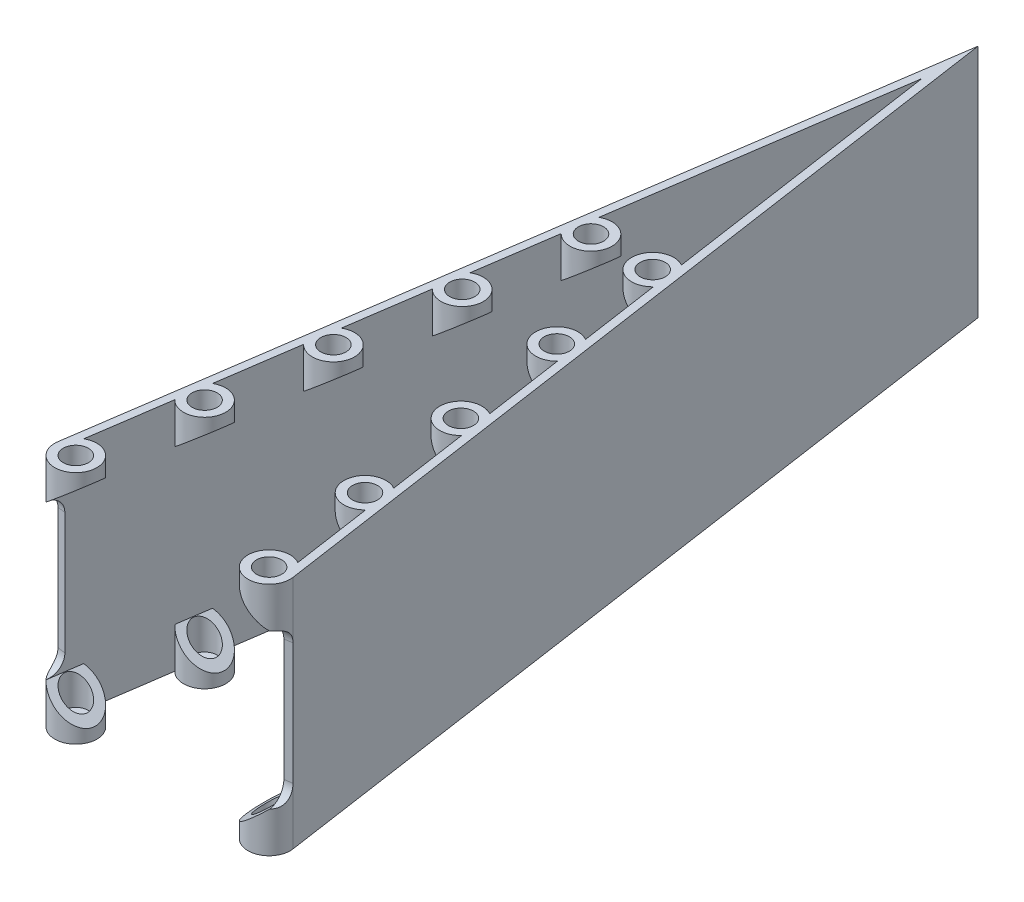
from build123d import *

# Parameters (mm, degrees)
BOSS_EXTRUDE1_DEPTH            = 29
SKETCH2_R                      = 2.6
SKETCH2_R_2                    = 1.55
BOSS_EXTRUDE3_DEPTH            = 5
CUT_EXTRUDE1_REACH             = 108.142
CUT_EXTRUDE1_DIRECTION_2_DEPTH = 107.141922264
CUT_EXTRUDE2_REACH             = 108.142
CUT_EXTRUDE2_DIRECTION_2_DEPTH = 107.141922264
FILLET1_R                      = 2
SKETCH6_R                      = 1.55
BOSS_EXTRUDE4_DEPTH            = 1


with BuildPart() as part:
    # Sketch1 → Boss-Extrude1 (new body)
    with BuildSketch(Plane(origin=(0, 0, 0), x_dir=(1, 0, 0), z_dir=(0, 1, 0))):
        Polygon((-13.5, 0), (0, 92.188031325), (13.5, 0), (14.489447114, 0.144894471), (0, 99.089605913), (-14.489447114, 0.144894471), align=None)
    extrude(amount=BOSS_EXTRUDE1_DEPTH)

    # Sketch2 → Boss-Extrude3 (add)
    # profile 1 of 10: a face of its own
    with BuildSketch(Plane(origin=(0, 0, 0), x_dir=(1, 0, 0), z_dir=(0, 1, 0))):
        with Locations((11.916884617, -0.231831154)):
            Circle(SKETCH2_R)
        with Locations(Location((11.916884617, -0.231831154, 0), (0, 0, 270))):
            Circle(SKETCH2_R_2, mode=Mode.SUBTRACT)
    # profile 2 of 10: a face of its own
    with BuildSketch(Plane(origin=(0, 0, 0), x_dir=(1, 0, 0), z_dir=(0, 1, 0))):
        with Locations((9.888362021, 13.620428448)):
            Circle(SKETCH2_R)
        with Locations(Location((9.888362021, 13.620428448, 0), (0, 0, 270))):
            Circle(SKETCH2_R_2, mode=Mode.SUBTRACT)
    # profile 3 of 10: a face of its own
    with BuildSketch(Plane(origin=(0, 0, 0), x_dir=(1, 0, 0), z_dir=(0, 1, 0))):
        with Locations((7.859839425, 27.47268805)):
            Circle(SKETCH2_R)
        with Locations(Location((7.859839425, 27.47268805, 0), (0, 0, 270))):
            Circle(SKETCH2_R_2, mode=Mode.SUBTRACT)
    # profile 4 of 10: a face of its own
    with BuildSketch(Plane(origin=(0, 0, 0), x_dir=(1, 0, 0), z_dir=(0, 1, 0))):
        with Locations((5.831316829, 41.324947652)):
            Circle(SKETCH2_R)
        with Locations(Location((5.831316829, 41.324947652, 0), (0, 0, 270))):
            Circle(SKETCH2_R_2, mode=Mode.SUBTRACT)
    # profile 5 of 10: a face of its own
    with BuildSketch(Plane(origin=(0, 0, 0), x_dir=(1, 0, 0), z_dir=(0, 1, 0))):
        with Locations((3.802794233, 55.177207254)):
            Circle(SKETCH2_R)
        with Locations(Location((3.802794233, 55.177207254, 0), (0, 0, 270))):
            Circle(SKETCH2_R_2, mode=Mode.SUBTRACT)
    # profile 6 of 10: a face of its own
    with BuildSketch(Plane(origin=(0, 0, 0), x_dir=(1, 0, 0), z_dir=(0, 1, 0))):
        with Locations((-11.916884617, -0.231831154)):
            Circle(SKETCH2_R)
        with Locations(Location((-11.916884617, -0.231831154, 0), (0, 0, 90))):
            Circle(SKETCH2_R_2, mode=Mode.SUBTRACT)
    # profile 7 of 10: a face of its own
    with BuildSketch(Plane(origin=(0, 0, 0), x_dir=(1, 0, 0), z_dir=(0, 1, 0))):
        with Locations((-9.888362021, 13.620428448)):
            Circle(SKETCH2_R)
        with Locations(Location((-9.888362021, 13.620428448, 0), (0, 0, 90))):
            Circle(SKETCH2_R_2, mode=Mode.SUBTRACT)
    # profile 8 of 10: a face of its own
    with BuildSketch(Plane(origin=(0, 0, 0), x_dir=(1, 0, 0), z_dir=(0, 1, 0))):
        with Locations((-7.859839425, 27.47268805)):
            Circle(SKETCH2_R)
        with Locations(Location((-7.859839425, 27.47268805, 0), (0, 0, 90))):
            Circle(SKETCH2_R_2, mode=Mode.SUBTRACT)
    # profile 9 of 10: a face of its own
    with BuildSketch(Plane(origin=(0, 0, 0), x_dir=(1, 0, 0), z_dir=(0, 1, 0))):
        with Locations((-5.831316829, 41.324947652)):
            Circle(SKETCH2_R)
        with Locations(Location((-5.831316829, 41.324947652, 0), (0, 0, 90))):
            Circle(SKETCH2_R_2, mode=Mode.SUBTRACT)
    # profile 10 of 10: a face of its own
    with BuildSketch(Plane(origin=(0, 0, 0), x_dir=(1, 0, 0), z_dir=(0, 1, 0))):
        with Locations((-3.802794233, 55.177207254)):
            Circle(SKETCH2_R)
        with Locations(Location((-3.802794233, 55.177207254, 0), (0, 0, 90))):
            Circle(SKETCH2_R_2, mode=Mode.SUBTRACT)
    boss_extrude3 = extrude(amount=BOSS_EXTRUDE3_DEPTH)

    # Cut-Extrude1: up to this face of the body (flat: up to its plane)
    cut_extrude1_end = Plane(part.part.faces().sort_by_distance((-6.671349584, 14.924053366, -46.631099147))[0])
    # Sketch4 → Cut-Extrude1 (cut, up to the picked face)
    with BuildSketch(Plane(origin=(0.283424505, 0, 1.935433121), x_dir=(0.9894471144188783, 0, -0.14489447114419254), z_dir=(0.14489447114419252, 0, 0.9894471144188782)), mode=Mode.PRIVATE) as cut_extrude1_sk1:
        Polygon((13.357536045, 5), (9.157536045, 5), (9.157536045, 1.475781549), align=None)
    cut_extrude1_tool1 = split(extrude(cut_extrude1_sk1.sketch, amount=-CUT_EXTRUDE1_REACH, mode=Mode.PRIVATE), bisect_by=cut_extrude1_end, keep=Keep.BOTH, mode=Mode.PRIVATE)
    cut_extrude1 = cut_extrude1_tool1.solids().sort_by(Axis((10.729548, 3.825261, 0.405705), (-0.14489447114419252, 0, -0.9894471144188782)))[0]
    add(cut_extrude1, mode=Mode.SUBTRACT)

    # Sketch4 → Cut-Extrude1 direction 2 (cut)
    with BuildSketch(Plane(origin=(0.283424505, 0, 1.935433121), x_dir=(0.9894471144188783, 0, -0.14489447114419254), z_dir=(0.14489447114419252, 0, 0.9894471144188782))):
        Polygon((13.357536045, 5), (9.157536045, 5), (9.157536045, 1.475781549), align=None)
    cut_extrude1_direction_2 = extrude(amount=CUT_EXTRUDE1_DIRECTION_2_DEPTH, mode=Mode.SUBTRACT)

    # Cut-Extrude2: up to this face of the body (flat: up to its plane)
    cut_extrude2_end = Plane(part.part.faces().sort_by_distance((6.671349584, 14.924053366, -46.631099147))[0])
    # Sketch5 → Cut-Extrude2 (cut, up to the picked face)
    with BuildSketch(Plane(origin=(-0.283424505, 0, 1.935433121), x_dir=(0.9894471144188784, 0, 0.14489447114419146), z_dir=(-0.14489447114419146, 0, 0.9894471144188784)), mode=Mode.PRIVATE) as cut_extrude2_sk1:
        Polygon((-9.157536045, 5), (-9.157536045, 1.475781549), (-13.357536045, 5), align=None)
    cut_extrude2_tool1 = split(extrude(cut_extrude2_sk1.sketch, amount=-CUT_EXTRUDE2_REACH, mode=Mode.PRIVATE), bisect_by=cut_extrude2_end, keep=Keep.BOTH, mode=Mode.PRIVATE)
    cut_extrude2 = cut_extrude2_tool1.solids().sort_by(Axis((-10.729548, 3.825261, 0.405705), (0.14489447114419146, 0, -0.9894471144188784)))[0]
    add(cut_extrude2, mode=Mode.SUBTRACT)

    # Sketch5 → Cut-Extrude2 direction 2 (cut)
    with BuildSketch(Plane(origin=(-0.283424505, 0, 1.935433121), x_dir=(0.9894471144188784, 0, 0.14489447114419146), z_dir=(-0.14489447114419146, 0, 0.9894471144188784))):
        Polygon((-9.157536045, 5), (-9.157536045, 1.475781549), (-13.357536045, 5), align=None)
    cut_extrude2_direction_2 = extrude(amount=CUT_EXTRUDE2_DIRECTION_2_DEPTH, mode=Mode.SUBTRACT)

    # Mirror2: Boss-Extrude3, Cut-Extrude1, Cut-Extrude1 direction 2, Cut-Extrude2, Cut-Extrude2 direction 2 across plane
    add(boss_extrude3.mirror(Plane.ZX.offset(14.5)))
    add(cut_extrude1.mirror(Plane.ZX.offset(14.5)), mode=Mode.SUBTRACT)
    add(cut_extrude1_direction_2.mirror(Plane.ZX.offset(14.5)), mode=Mode.SUBTRACT)
    add(cut_extrude2.mirror(Plane.ZX.offset(14.5)), mode=Mode.SUBTRACT)
    add(cut_extrude2_direction_2.mirror(Plane.ZX.offset(14.5)), mode=Mode.SUBTRACT)

    # Fillet1
    # the kernel refuses this fillet: 2 mm, written as the material it adds along each edge
    with BuildSketch(Plane(origin=(13.5, 5, 0), x_dir=(0, 1, 0), z_dir=(0.9894471144188783, 0, -0.1448944711441925))) as fillet1_piece_1_section:
        with BuildLine():
            CenterArc((FILLET1_R, FILLET1_R), FILLET1_R, 180, 90)
            Line((0, FILLET1_R), (0, 0))
            Line((0, 0), (FILLET1_R, 0))
        make_face()
    fillet1_piece_1 = extrude(amount=6, mode=Mode.PRIVATE)
    fillet1_piece_1 = fillet1_piece_1 & Plane(origin=(11.916884617, 5.699977741, 0.231831154), x_dir=(1, 0, 0), z_dir=(0, -1, 0)) * Cylinder(2.6, 20, mode=Mode.PRIVATE)
    add(fillet1_piece_1)
    with BuildSketch(Plane(origin=(13.5, 24, 0), x_dir=(0, -1, 0), z_dir=(0.9894471144188783, 0, -0.1448944711441925))) as fillet1_piece_2_section:
        with BuildLine():
            CenterArc((FILLET1_R, -FILLET1_R), FILLET1_R, 90, 90)
            Line((0, -FILLET1_R), (0, 0))
            Line((0, 0), (FILLET1_R, 0))
        make_face()
    fillet1_piece_2 = extrude(amount=6, mode=Mode.PRIVATE)
    fillet1_piece_2 = fillet1_piece_2 & Plane(origin=(11.916884617, 23.30002226, 0.231831154), x_dir=(1, 0, 0), z_dir=(0, 1, 0)) * Cylinder(2.6, 20, mode=Mode.PRIVATE)
    add(fillet1_piece_2)
    with BuildSketch(Plane(origin=(-19.436682687, 24, -0.869366827), x_dir=(0, -1, 0), z_dir=(0.9894471144188784, 0, 0.1448944711441914))) as fillet1_piece_3_section:
        with BuildLine():
            CenterArc((FILLET1_R, -FILLET1_R), FILLET1_R, 90, 90)
            Line((0, -FILLET1_R), (0, 0))
            Line((0, 0), (FILLET1_R, 0))
        make_face()
    fillet1_piece_3 = extrude(amount=6, mode=Mode.PRIVATE)
    fillet1_piece_3 = fillet1_piece_3 & Plane(origin=(-11.916884617, 23.777637105, 0.231831154), x_dir=(1, 0, 0), z_dir=(0, 1, 0)) * Cylinder(2.6, 21, mode=Mode.PRIVATE)
    add(fillet1_piece_3)
    with BuildSketch(Plane(origin=(-19.436682687, 5, -0.869366827), x_dir=(-0.1448944711441914, 0, 0.9894471144188784), z_dir=(0.9894471144188784, 0, 0.1448944711441914))) as fillet1_piece_4_section:
        with BuildLine():
            CenterArc((FILLET1_R, -FILLET1_R), FILLET1_R, 90, 90)
            Line((0, -FILLET1_R), (0, 0))
            Line((0, 0), (FILLET1_R, 0))
        make_face()
    fillet1_piece_4 = extrude(amount=6, mode=Mode.PRIVATE)
    fillet1_piece_4 = fillet1_piece_4 & Plane(origin=(-11.916884617, 5.222362792, 0.231831154), x_dir=(1, 0, 0), z_dir=(0, -1, 0)) * Cylinder(2.6, 21, mode=Mode.PRIVATE)
    add(fillet1_piece_4)

    # Sketch6 → Boss-Extrude4 (add)
    with BuildSketch(Plane.XZ):
        with Locations(Location((3.802794233, -55.177207254, 0), (0, 0, 270))):
            Circle(SKETCH6_R)
        with Locations(Location((-3.802794233, -55.177207254, 0), (0, 0, 270))):
            Circle(SKETCH6_R)
        with Locations(Location((-5.831316829, -41.324947652, 0), (0, 0, 270))):
            Circle(SKETCH6_R)
        with Locations(Location((5.831316829, -41.324947652, 0), (0, 0, 270))):
            Circle(SKETCH6_R)
        with Locations(Location((7.859839425, -27.47268805, 0), (0, 0, 270))):
            Circle(SKETCH6_R)
        with Locations(Location((-7.859839425, -27.47268805, 0), (0, 0, 270))):
            Circle(SKETCH6_R)
        with Locations(Location((-9.888362021, -13.620428448, 0), (0, 0, 270))):
            Circle(SKETCH6_R)
        with Locations(Location((9.888362021, -13.620428448, 0), (0, 0, 270))):
            Circle(SKETCH6_R)
        with Locations(Location((11.916884617, 0.231831154, 0), (0, 0, 270))):
            Circle(SKETCH6_R)
        with Locations(Location((-11.916884617, 0.231831154, 0), (0, 0, 270))):
            Circle(SKETCH6_R)
    extrude(amount=-BOSS_EXTRUDE4_DEPTH)


solid = part.part
